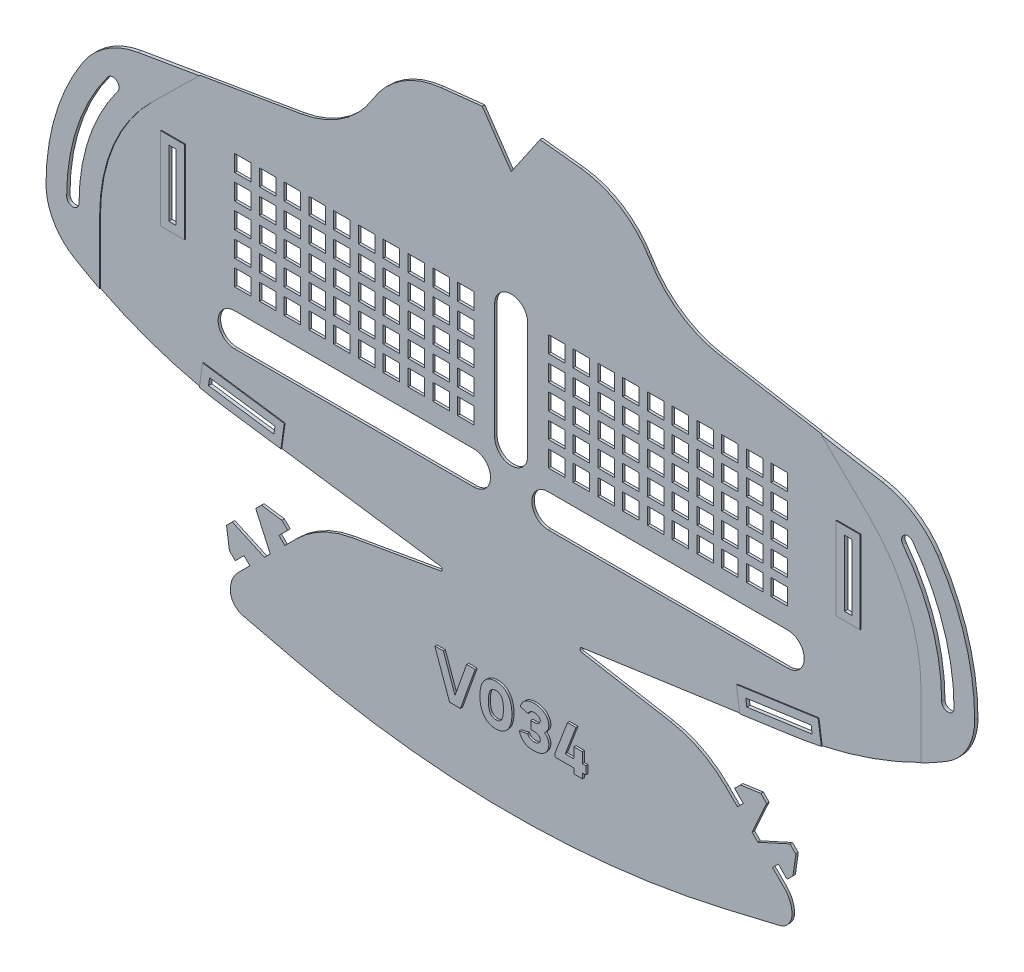
from build123d import *

# Parameters (mm, degrees)
MAIN_SHAPE_DEPTH                   = 0.6
ELASTIC_ATTACHMENT_POINTS_DEPTH    = 184.525502315
REINFORCED_ATTACHMENT_POINTS_DEPTH = 0.2
TAB_SLITS_DEPTH                    = 184.525502315
REINFORCED_TAB_SLITS_DEPTH         = 0.2
TAB_FLEX_RELIEF_DEPTH              = 184.525502315
TAB_FLEX_RELIEF_DEPTH_BACK         = 184.525502315
SKETCH3_W                          = 4
SKETCH3_H                          = 4
BREATHING_SLITS_DEPTH              = 184.525502315
VERSION_NUMBER_DEPTH               = 0.5
FILLET1_R                          = 0.5
TAB_OVERLAY_SLIT_DEPTH             = 184.525502394
TAB_OVERLAY_SLIT_DEPTH_BACK        = 184.525502394
SKETCH12_W                         = 1.8
SKETCH12_H                         = 16
SKETCH13_W                         = 5.8
SKETCH13_H                         = 20
SKETCH13_W_2                       = 1.8
SKETCH13_H_2                       = 16
TAB_OVERLAY_REINFORCEMENT_DEPTH    = 0.2


with BuildPart() as part:
    # Sketch1 → Main Shape (new body)
    with BuildSketch(Plane.XY):
        with BuildLine():
            Line((0, -10.235233266), (-7, 0))
            Line((-7, 0), (-16.941855461, -1.076805455))
            ThreePointArc((-16.941855461, -1.076805455), (-26.448172688, -4.42923559), (-33.461443341, -11.669600897))
            ThreePointArc((-33.461443341, -11.669600897), (-40.804108255, -19.481824954), (-50.74391922, -23.5))
            Line((-50.74391922, -23.5), (-90.180351554, -30.190874742))
            ThreePointArc((-90.180351554, -30.190874742), (-97.811505455, -33.190405434), (-103.597722286, -39))
            ThreePointArc((-103.597722286, -39), (-110.227482046, -53.35351039), (-112.5, -69))
            ThreePointArc((-112.5, -69), (-110.685143325, -75.893640703), (-105.711102551, -81))
            ThreePointArc((-105.711102551, -81), (-87.655491519, -89.524485559), (-68.266232563, -94.291935705))
            Line((-68.266232563, -94.291935705), (-14, -102))
            Line((-14, -102), (-38.626554922, -106.304973016))
            ThreePointArc((-38.626554922, -106.304973016), (-45.849449199, -108.748014338), (-52, -113.254607005))
            Line((-52, -113.254607005), (-54.828307349, -116.0831539))
            Line((-54.828307349, -116.0831539), (-56.242580797, -114.669000226))
            Line((-56.242580797, -114.669000226), (-54.121350285, -112.547590054))
            Line((-54.121350285, -112.547590054), (-55.535623732, -111.13343638))
            Line((-55.535623732, -111.13343638), (-60.48540114, -110.426539202))
            Line((-60.48540114, -110.426539202), (-68.970323187, -118.912179887))
            Line((-68.970323187, -118.912179887), (-68.263006804, -123.861897408))
            Line((-68.263006804, -123.861897408), (-66.848733357, -125.276051082))
            Line((-66.848733357, -125.276051082), (-64.727502845, -123.154640911))
            Line((-64.727502845, -123.154640911), (-63.313229397, -124.568794586))
            Line((-63.313229397, -124.568794586), (-66.141536747, -127.397341481))
            ThreePointArc((-66.141536747, -127.397341481), (-67.550417669, -129.506025763), (-68.045148042, -131.993340924))
            ThreePointArc((-68.045148042, -131.993340924), (-67.183295285, -134.473669911), (-64.9691321, -135.885159709))
            Line((-64.9691321, -135.885159709), (-52.436095294, -138.860716087))
            ThreePointArc((-52.436095294, -138.860716087), (-26.397134772, -143.459954927), (0, -145))
            ThreePointArc((0, -145), (26.397134772, -143.459954927), (52.436095294, -138.860716087))
            Line((52.436095294, -138.860716087), (64.9691321, -135.885159709))
            ThreePointArc((64.9691321, -135.885159709), (67.183295285, -134.473669911), (68.045148042, -131.993340924))
            ThreePointArc((68.045148042, -131.993340924), (67.550417669, -129.506025763), (66.141536747, -127.397341481))
            Line((66.141536747, -127.397341481), (63.313229397, -124.568794586))
            Line((63.313229397, -124.568794586), (64.727502845, -123.154640911))
            Line((64.727502845, -123.154640911), (66.848733357, -125.276051082))
            Line((66.848733357, -125.276051082), (68.263006804, -123.861897408))
            Line((68.263006804, -123.861897408), (68.970323187, -118.912179887))
            Line((68.970323187, -118.912179887), (60.48540114, -110.426539202))
            Line((60.48540114, -110.426539202), (55.535623732, -111.13343638))
            Line((55.535623732, -111.13343638), (54.121350285, -112.547590054))
            Line((54.121350285, -112.547590054), (56.242580797, -114.669000226))
            Line((56.242580797, -114.669000226), (54.828307349, -116.0831539))
            Line((54.828307349, -116.0831539), (52, -113.254607005))
            ThreePointArc((52, -113.254607005), (45.849449199, -108.748014338), (38.626554922, -106.304973016))
            Line((38.626554922, -106.304973016), (14, -102))
            Line((14, -102), (68.266232563, -94.291935705))
            ThreePointArc((68.266232563, -94.291935705), (87.655491519, -89.524485559), (105.711102551, -81))
            ThreePointArc((105.711102551, -81), (110.685143325, -75.893640703), (112.5, -69))
            ThreePointArc((112.5, -69), (110.227482046, -53.35351039), (103.597722286, -39))
            ThreePointArc((103.597722286, -39), (97.811505455, -33.190405434), (90.180351554, -30.190874742))
            Line((90.180351554, -30.190874742), (50.74391922, -23.5))
            ThreePointArc((50.74391922, -23.5), (40.804108255, -19.481824954), (33.461443341, -11.669600897))
            ThreePointArc((33.461443341, -11.669600897), (26.448172688, -4.42923559), (16.941855461, -1.076805455))
            Line((16.941855461, -1.076805455), (7, 0))
            Line((7, 0), (0, -10.235233266))
        make_face()
    extrude(amount=MAIN_SHAPE_DEPTH)

    # Sketch2 → Elastic Attachment Points (cut, through all)
    with BuildSketch(Plane.XY.offset(0.6)):
        with BuildLine():
            ThreePointArc((-97.5, -39), (-104.934164903, -53.188611699), (-107.5, -69))
            ThreePointArc((-107.5, -69), (-106, -70.5), (-104.5, -69))
            ThreePointArc((-104.5, -69), (-102.088115008, -54.137294997), (-95.1, -40.8))
            ThreePointArc((-95.1, -40.8), (-95.4, -38.7), (-97.5, -39))
        make_face()
        with BuildLine():
            ThreePointArc((97.5, -39), (104.934164903, -53.188611699), (107.5, -69))
            ThreePointArc((107.5, -69), (106, -70.5), (104.5, -69))
            ThreePointArc((104.5, -69), (102.088115008, -54.137294997), (95.1, -40.8))
            ThreePointArc((95.1, -40.8), (95.4, -38.7), (97.5, -39))
        make_face()
    extrude(amount=-ELASTIC_ATTACHMENT_POINTS_DEPTH, mode=Mode.SUBTRACT)

    # Sketch7 → Reinforced Attachment Points (add)
    # profile 1 of 2: a face of its own
    with BuildSketch(Plane.XY.offset(0.6)):
        with BuildLine():
            Line((-99.5, -69), (-99.5, -84.438405623))
            ThreePointArc((-99.5, -84.438405623), (-102.636073846, -82.774338486), (-105.711102551, -81))
            ThreePointArc((-105.711102551, -81), (-110.685143325, -75.893640703), (-112.5, -69))
            ThreePointArc((-112.5, -69), (-110.227482046, -53.35351039), (-103.597722286, -39))
            ThreePointArc((-103.597722286, -39), (-97.811505455, -33.190405434), (-90.180351554, -30.190874742))
            Line((-90.180351554, -30.190874742), (-75.331937335, -27.671659038))
            Line((-75.331937335, -27.671659038), (-86.893876913, -39))
            ThreePointArc((-86.893876913, -39), (-96.22042633, -52.729517991), (-99.5, -69))
        make_face()
        with BuildLine():
            ThreePointArc((-107.5, -69), (-106, -70.5), (-104.5, -69))
            ThreePointArc((-104.5, -69), (-102.088115008, -54.137294997), (-95.1, -40.8))
            ThreePointArc((-95.1, -40.8), (-95.4, -38.7), (-97.5, -39))
            ThreePointArc((-97.5, -39), (-104.934164903, -53.188611699), (-107.5, -69))
        make_face(mode=Mode.SUBTRACT)
    # profile 2 of 2: a face of its own
    with BuildSketch(Plane.XY.offset(0.6)):
        with BuildLine():
            Line((75.331937335, -27.671659038), (90.180351554, -30.190874742))
            ThreePointArc((90.180351554, -30.190874742), (97.811505455, -33.190405434), (103.597722286, -39))
            ThreePointArc((103.597722286, -39), (110.227482046, -53.35351039), (112.5, -69))
            ThreePointArc((112.5, -69), (110.685143325, -75.893640703), (105.711102551, -81))
            ThreePointArc((105.711102551, -81), (102.636073846, -82.774338486), (99.5, -84.438405623))
            Line((99.5, -84.438405623), (99.5, -69))
            ThreePointArc((99.5, -69), (96.22042633, -52.729517991), (86.893876913, -39))
            Line((86.893876913, -39), (75.331937335, -27.671659038))
        make_face()
        with BuildLine():
            ThreePointArc((104.5, -69), (106, -70.5), (107.5, -69))
            ThreePointArc((107.5, -69), (104.934164903, -53.188611699), (97.5, -39))
            ThreePointArc((97.5, -39), (95.4, -38.7), (95.1, -40.8))
            ThreePointArc((95.1, -40.8), (102.088115008, -54.137294997), (104.5, -69))
        make_face(mode=Mode.SUBTRACT)
    extrude(amount=REINFORCED_ATTACHMENT_POINTS_DEPTH)

    # Sketch6 → Tab Slits (cut, through all)
    with BuildSketch(Plane.XY.offset(0.6)):
        Polygon((-73.122472744, -91.582072346), (-57.281477317, -93.832153206), (-57.02834322, -92.050041221), (-72.869338647, -89.79996036), align=None)
        Polygon((73.122472744, -91.582072346), (72.869338647, -89.79996036), (57.02834322, -92.050041221), (57.281477317, -93.832153206), align=None)
    extrude(amount=-TAB_SLITS_DEPTH, mode=Mode.SUBTRACT)

    # Sketch9 → Reinforced Tab Slits (add)
    # profile 1 of 2: a face of its own
    with BuildSketch(Plane.XY.offset(0.6)):
        with BuildLine():
            Line((-55.582612996, -96.093537742), (-54.766958684, -90.3511769))
            Line((-54.766958684, -90.3511769), (-74.568202968, -87.538575825))
            Line((-74.568202968, -87.538575825), (-75.347469499, -93.024759795))
            ThreePointArc((-75.347469499, -93.024759795), (-71.81824936, -93.72204393), (-68.266232563, -94.291935705))
            Line((-68.266232563, -94.291935705), (-55.582612996, -96.093537742))
        make_face()
        Polygon((-57.281477317, -93.832153206), (-57.02834322, -92.050041221), (-72.869338647, -89.79996036), (-73.122472744, -91.582072346), align=None, mode=Mode.SUBTRACT)
    # profile 2 of 2: a face of its own
    with BuildSketch(Plane.XY.offset(0.6)):
        with BuildLine():
            Line((68.266232563, -94.291935705), (55.582612996, -96.093537742))
            Line((55.582612996, -96.093537742), (54.766958684, -90.3511769))
            Line((54.766958684, -90.3511769), (74.568202968, -87.538575825))
            Line((74.568202968, -87.538575825), (75.347469499, -93.024759795))
            ThreePointArc((75.347469499, -93.024759795), (71.81824936, -93.72204393), (68.266232563, -94.291935705))
        make_face()
        Polygon((57.02834322, -92.050041221), (72.869338647, -89.79996036), (73.122472744, -91.582072346), (57.281477317, -93.832153206), align=None, mode=Mode.SUBTRACT)
    extrude(amount=REINFORCED_TAB_SLITS_DEPTH)

    # Sketch11 → Tab Flex Relief (cut, two sides: drawn at the far end of the back side and taken through both)
    with BuildSketch(Plane.XY.offset(0.6).offset(-TAB_FLEX_RELIEF_DEPTH_BACK)):
        Polygon((-67.556169513, -117.49790644), (-59.777845211, -121.033110967), (-58.363691536, -119.618837519), (-61.899554814, -111.840812649), align=None)
        Polygon((61.899554814, -111.840812649), (67.556169513, -117.49790644), (59.777845211, -121.033110967), (58.363691536, -119.618837519), align=None)
    extrude(amount=TAB_FLEX_RELIEF_DEPTH + TAB_FLEX_RELIEF_DEPTH_BACK, mode=Mode.SUBTRACT)

    # Sketch3 → Breathing Slits (cut, through all)
    with BuildSketch(Plane.XY.offset(0.6)):
        with Locations((-11, -41.9)):
            Rectangle(SKETCH3_W, SKETCH3_H)
        with BuildLine():
            Line((4, -39.9), (4, -67.9))
            ThreePointArc((4, -67.9), (0, -71.9), (-4, -67.9))
            Line((-4, -67.9), (-4, -39.9))
            ThreePointArc((-4, -39.9), (0, -35.9), (4, -39.9))
        make_face()
        with Locations((-17, -41.9)):
            Rectangle(SKETCH3_W, SKETCH3_H)
        with Locations((-23, -41.9)):
            Rectangle(SKETCH3_W, SKETCH3_H)
        with Locations((-29, -41.9)):
            Rectangle(SKETCH3_W, SKETCH3_H)
        with Locations((-35, -41.9)):
            Rectangle(SKETCH3_W, SKETCH3_H)
        with BuildLine():
            Line((-67, -72.9), (-9, -72.9))
            ThreePointArc((-9, -72.9), (-5, -76.9), (-9, -80.9))
            Line((-9, -80.9), (-67, -80.9))
            ThreePointArc((-67, -80.9), (-71, -76.9), (-67, -72.9))
        make_face()
        with BuildLine():
            Line((67, -72.9), (9, -72.9))
            ThreePointArc((9, -72.9), (5, -76.9), (9, -80.9))
            Line((9, -80.9), (67, -80.9))
            ThreePointArc((67, -80.9), (71, -76.9), (67, -72.9))
        make_face()
        with Locations((-41, -41.9)):
            Rectangle(SKETCH3_W, SKETCH3_H)
        with Locations((-47, -41.9)):
            Rectangle(SKETCH3_W, SKETCH3_H)
        with Locations((-53, -41.9)):
            Rectangle(SKETCH3_W, SKETCH3_H)
        with Locations((-59, -41.9)):
            Rectangle(SKETCH3_W, SKETCH3_H)
        with Locations((-65, -41.9)):
            Rectangle(SKETCH3_W, SKETCH3_H)
        with Locations((-17, -47.9)):
            Rectangle(SKETCH3_W, SKETCH3_H)
        with Locations((-23, -47.9)):
            Rectangle(SKETCH3_W, SKETCH3_H)
        with Locations((-29, -47.9)):
            Rectangle(SKETCH3_W, SKETCH3_H)
        with Locations((-35, -47.9)):
            Rectangle(SKETCH3_W, SKETCH3_H)
        with Locations((-41, -47.9)):
            Rectangle(SKETCH3_W, SKETCH3_H)
        with Locations((-47, -47.9)):
            Rectangle(SKETCH3_W, SKETCH3_H)
        with Locations((-53, -47.9)):
            Rectangle(SKETCH3_W, SKETCH3_H)
        with Locations((-59, -47.9)):
            Rectangle(SKETCH3_W, SKETCH3_H)
        with Locations((-65, -47.9)):
            Rectangle(SKETCH3_W, SKETCH3_H)
        with Locations((-17, -53.9)):
            Rectangle(SKETCH3_W, SKETCH3_H)
        with Locations((-23, -53.9)):
            Rectangle(SKETCH3_W, SKETCH3_H)
        with Locations((-29, -53.9)):
            Rectangle(SKETCH3_W, SKETCH3_H)
        with Locations((-35, -53.9)):
            Rectangle(SKETCH3_W, SKETCH3_H)
        with Locations((-41, -53.9)):
            Rectangle(SKETCH3_W, SKETCH3_H)
        with Locations((-47, -53.9)):
            Rectangle(SKETCH3_W, SKETCH3_H)
        with Locations((-53, -53.9)):
            Rectangle(SKETCH3_W, SKETCH3_H)
        with Locations((-59, -53.9)):
            Rectangle(SKETCH3_W, SKETCH3_H)
        with Locations((-65, -53.9)):
            Rectangle(SKETCH3_W, SKETCH3_H)
        with Locations((-17, -59.9)):
            Rectangle(SKETCH3_W, SKETCH3_H)
        with Locations((-23, -59.9)):
            Rectangle(SKETCH3_W, SKETCH3_H)
        with Locations((-29, -59.9)):
            Rectangle(SKETCH3_W, SKETCH3_H)
        with Locations((-35, -59.9)):
            Rectangle(SKETCH3_W, SKETCH3_H)
        with Locations((-41, -59.9)):
            Rectangle(SKETCH3_W, SKETCH3_H)
        with Locations((-47, -59.9)):
            Rectangle(SKETCH3_W, SKETCH3_H)
        with Locations((-53, -59.9)):
            Rectangle(SKETCH3_W, SKETCH3_H)
        with Locations((-59, -59.9)):
            Rectangle(SKETCH3_W, SKETCH3_H)
        with Locations((-65, -59.9)):
            Rectangle(SKETCH3_W, SKETCH3_H)
        with Locations((-17, -65.9)):
            Rectangle(SKETCH3_W, SKETCH3_H)
        with Locations((-23, -65.9)):
            Rectangle(SKETCH3_W, SKETCH3_H)
        with Locations((-29, -65.9)):
            Rectangle(SKETCH3_W, SKETCH3_H)
        with Locations((-35, -65.9)):
            Rectangle(SKETCH3_W, SKETCH3_H)
        with Locations((-41, -65.9)):
            Rectangle(SKETCH3_W, SKETCH3_H)
        with Locations((-47, -65.9)):
            Rectangle(SKETCH3_W, SKETCH3_H)
        with Locations((-53, -65.9)):
            Rectangle(SKETCH3_W, SKETCH3_H)
        with Locations((-59, -65.9)):
            Rectangle(SKETCH3_W, SKETCH3_H)
        with Locations((-65, -65.9)):
            Rectangle(SKETCH3_W, SKETCH3_H)
        with Locations((-11, -47.9)):
            Rectangle(SKETCH3_W, SKETCH3_H)
        with Locations((-11, -53.9)):
            Rectangle(SKETCH3_W, SKETCH3_H)
        with Locations((-11, -59.9)):
            Rectangle(SKETCH3_W, SKETCH3_H)
        with Locations((-11, -65.9)):
            Rectangle(SKETCH3_W, SKETCH3_H)
        with Locations((11, -65.9)):
            Rectangle(SKETCH3_W, SKETCH3_H)
        with Locations((11, -59.9)):
            Rectangle(SKETCH3_W, SKETCH3_H)
        with Locations((11, -53.9)):
            Rectangle(SKETCH3_W, SKETCH3_H)
        with Locations((11, -47.9)):
            Rectangle(SKETCH3_W, SKETCH3_H)
        with Locations((65, -65.9)):
            Rectangle(SKETCH3_W, SKETCH3_H)
        with Locations((59, -65.9)):
            Rectangle(SKETCH3_W, SKETCH3_H)
        with Locations((53, -65.9)):
            Rectangle(SKETCH3_W, SKETCH3_H)
        with Locations((47, -65.9)):
            Rectangle(SKETCH3_W, SKETCH3_H)
        with Locations((41, -65.9)):
            Rectangle(SKETCH3_W, SKETCH3_H)
        with Locations((35, -65.9)):
            Rectangle(SKETCH3_W, SKETCH3_H)
        with Locations((29, -65.9)):
            Rectangle(SKETCH3_W, SKETCH3_H)
        with Locations((23, -65.9)):
            Rectangle(SKETCH3_W, SKETCH3_H)
        with Locations((17, -65.9)):
            Rectangle(SKETCH3_W, SKETCH3_H)
        with Locations((65, -59.9)):
            Rectangle(SKETCH3_W, SKETCH3_H)
        with Locations((59, -59.9)):
            Rectangle(SKETCH3_W, SKETCH3_H)
        with Locations((53, -59.9)):
            Rectangle(SKETCH3_W, SKETCH3_H)
        with Locations((47, -59.9)):
            Rectangle(SKETCH3_W, SKETCH3_H)
        with Locations((41, -59.9)):
            Rectangle(SKETCH3_W, SKETCH3_H)
        with Locations((35, -59.9)):
            Rectangle(SKETCH3_W, SKETCH3_H)
        with Locations((29, -59.9)):
            Rectangle(SKETCH3_W, SKETCH3_H)
        with Locations((23, -59.9)):
            Rectangle(SKETCH3_W, SKETCH3_H)
        with Locations((17, -59.9)):
            Rectangle(SKETCH3_W, SKETCH3_H)
        with Locations((65, -53.9)):
            Rectangle(SKETCH3_W, SKETCH3_H)
        with Locations((59, -53.9)):
            Rectangle(SKETCH3_W, SKETCH3_H)
        with Locations((53, -53.9)):
            Rectangle(SKETCH3_W, SKETCH3_H)
        with Locations((47, -53.9)):
            Rectangle(SKETCH3_W, SKETCH3_H)
        with Locations((41, -53.9)):
            Rectangle(SKETCH3_W, SKETCH3_H)
        with Locations((35, -53.9)):
            Rectangle(SKETCH3_W, SKETCH3_H)
        with Locations((29, -53.9)):
            Rectangle(SKETCH3_W, SKETCH3_H)
        with Locations((23, -53.9)):
            Rectangle(SKETCH3_W, SKETCH3_H)
        with Locations((17, -53.9)):
            Rectangle(SKETCH3_W, SKETCH3_H)
        with Locations((65, -47.9)):
            Rectangle(SKETCH3_W, SKETCH3_H)
        with Locations((59, -47.9)):
            Rectangle(SKETCH3_W, SKETCH3_H)
        with Locations((53, -47.9)):
            Rectangle(SKETCH3_W, SKETCH3_H)
        with Locations((47, -47.9)):
            Rectangle(SKETCH3_W, SKETCH3_H)
        with Locations((41, -47.9)):
            Rectangle(SKETCH3_W, SKETCH3_H)
        with Locations((35, -47.9)):
            Rectangle(SKETCH3_W, SKETCH3_H)
        with Locations((29, -47.9)):
            Rectangle(SKETCH3_W, SKETCH3_H)
        with Locations((23, -47.9)):
            Rectangle(SKETCH3_W, SKETCH3_H)
        with Locations((17, -47.9)):
            Rectangle(SKETCH3_W, SKETCH3_H)
        with Locations((65, -41.9)):
            Rectangle(SKETCH3_W, SKETCH3_H)
        with Locations((59, -41.9)):
            Rectangle(SKETCH3_W, SKETCH3_H)
        with Locations((53, -41.9)):
            Rectangle(SKETCH3_W, SKETCH3_H)
        with Locations((47, -41.9)):
            Rectangle(SKETCH3_W, SKETCH3_H)
        with Locations((41, -41.9)):
            Rectangle(SKETCH3_W, SKETCH3_H)
        with Locations((35, -41.9)):
            Rectangle(SKETCH3_W, SKETCH3_H)
        with Locations((29, -41.9)):
            Rectangle(SKETCH3_W, SKETCH3_H)
        with Locations((23, -41.9)):
            Rectangle(SKETCH3_W, SKETCH3_H)
        with Locations((17, -41.9)):
            Rectangle(SKETCH3_W, SKETCH3_H)
        with Locations((11, -41.9)):
            Rectangle(SKETCH3_W, SKETCH3_H)
    extrude(amount=-BREATHING_SLITS_DEPTH, mode=Mode.SUBTRACT)

    # Sketch8 → Version Number (add)
    # profile 1 of 4: a face of its own
    with BuildSketch(Plane.XY.offset(0.6)):
        Polygon((-14.426521706, -128.5), (-11.791601071, -128.5), (-8.2201725, -118.5), (-10.283664563, -118.5), (-13.109061389, -126.420634921), (-15.934458214, -118.5), (-17.997950277, -118.5), align=None)
    # profile 2 of 4: a face of its own
    with BuildSketch(Plane.XY.offset(0.6)):
        with BuildLine():
            add(Edge.make_bspline(
                [(-3.19799782, -118.5), (-3.342363784, -118.505695671), (-3.625118931, -118.51685121), (-4.038253933, -118.5745591), (-4.426096636, -118.680335178), (-4.793298212, -118.819656178), (-5.135573783, -119.003303471), (-5.459366958, -119.221085059), (-5.752377573, -119.487440084), (-6.027832626, -119.785519386), (-6.273695806, -120.12453761), (-6.487131516, -120.500892889), (-6.669094292, -120.912503383), (-6.818015456, -121.360169436), (-6.933564505, -121.844506854), (-7.021318443, -122.364485904), (-7.072872883, -122.921030718), (-7.083529613, -123.303893775), (-7.089008194, -123.500722112)],
                knots=[0, 0, 0, 0, 0.970159994, 1.900155169, 2.79438565, 3.665191596, 4.532301255, 5.397946305, 6.279238358, 7.185391655, 8.120220805, 9.085107467, 10.08639026, 11.138349125, 12.249459105, 13.427760297, 14.677622047, 16, 16, 16, 16], degree=3))
            add(Edge.make_bspline(
                [(-7.089008194, -123.500722112), (-7.083584804, -123.69832053), (-7.073076177, -124.081196856), (-7.021109107, -124.637697099), (-6.933663218, -125.156966907), (-6.817553361, -125.641884177), (-6.669610698, -126.090648826), (-6.487064073, -126.502814664), (-6.273753768, -126.879260377), (-6.027672588, -127.218032326), (-5.753280851, -127.51659595), (-5.457813305, -127.779877259), (-5.136462062, -128.000979952), (-4.793104757, -128.183632701), (-4.426551703, -128.324409639), (-4.037598623, -128.425104033), (-3.625820303, -128.488808035), (-3.343038929, -128.496221224), (-3.198894854, -128.5)],
                knots=[0, 0, 0, 0, 1.327400251, 2.57203543, 3.750234214, 4.861247624, 5.917991082, 6.919186852, 7.883989653, 8.818737555, 9.724812096, 10.602616666, 11.47109776, 12.338132057, 13.208862319, 14.101698703, 15.032365954, 16, 16, 16, 16], degree=3))
            add(Edge.make_bspline(
                [(-3.198894854, -128.5), (-3.054755185, -128.496210687), (-2.771982456, -128.488776824), (-2.360142042, -128.425221319), (-1.970719711, -128.323813307), (-1.603358232, -128.184839888), (-1.260968753, -128.000200623), (-0.939922347, -127.779984633), (-0.644523678, -127.516566079), (-0.370113879, -127.218040576), (-0.124033252, -126.879258594), (0.08925949, -126.502813072), (0.271881367, -126.090657611), (0.419519105, -125.641847927), (0.536831956, -125.157235462), (0.619274102, -124.637275213), (0.676930327, -124.081441513), (0.684840695, -123.698369528), (0.688922079, -123.500722112)],
                knots=[0, 0, 0, 0, 0.96765053, 1.898333634, 2.791185227, 3.666728435, 4.529238626, 5.397734515, 6.275554038, 7.181644014, 8.116407839, 9.081227075, 10.082439899, 11.139201358, 12.250233695, 13.427610983, 14.672766316, 16, 16, 16, 16], degree=3))
            add(Edge.make_bspline(
                [(0.688922079, -123.500722112), (0.684781249, -123.303845261), (0.676724545, -122.920787111), (0.619480566, -122.364907693), (0.536732372, -121.844238468), (0.419982735, -121.360205444), (0.271364771, -120.912494629), (0.089326953, -120.500894477), (-0.124091224, -120.124539393), (-0.369953818, -119.785511139), (-0.645427056, -119.487469991), (-0.938368264, -119.220977415), (-1.261853126, -119.004075275), (-1.603164774, -118.818455332), (-1.971175337, -118.680915067), (-2.35949197, -118.574534625), (-2.772341048, -118.516562336), (-3.054825879, -118.506550382), (-3.198894854, -118.501444225)],
                knots=[0, 0, 0, 0, 1.322391154, 2.572941942, 3.750582404, 4.861863084, 5.913983562, 6.915420183, 7.880455081, 8.815427849, 9.721720359, 10.603147806, 11.468925845, 12.331628829, 13.207367743, 14.101735605, 15.031873656, 16, 16, 16, 16], degree=3))
            Line((-3.198894854, -118.501444225), (-3.19799782, -118.5))
        make_face()
        with BuildLine():
            add(Edge.make_bspline(
                [(-3.19799782, -126.579365079), (-3.267317368, -126.580142247), (-3.403327694, -126.581667111), (-3.600780931, -126.549518886), (-3.787232026, -126.50001124), (-3.961409321, -126.424863461), (-4.125204682, -126.32888552), (-4.275820225, -126.207295998), (-4.414179248, -126.063513987), (-4.541494306, -125.896932623), (-4.655365609, -125.703005633), (-4.753896598, -125.478827118), (-4.834634013, -125.222713054), (-4.903810771, -124.937433189), (-4.955062135, -124.621763618), (-4.993565701, -124.276117752), (-5.019432364, -123.899148475), (-5.022791639, -123.63702081), (-5.024538364, -123.500722112)],
                knots=[0, 0, 0, 0, 0.820209436, 1.609314487, 2.362064528, 3.101854642, 3.850272983, 4.605479342, 5.3882482, 6.210255141, 7.084711649, 8.047345167, 9.106040688, 10.263495908, 11.523832392, 12.893430008, 14.384674726, 16, 16, 16, 16], degree=3))
            add(Edge.make_bspline(
                [(-5.024538364, -123.500722112), (-5.022784753, -123.364424703), (-5.019412233, -123.102299516), (-4.993636589, -122.725313211), (-4.954743615, -122.378974061), (-4.904447331, -122.063111109), (-4.834229908, -121.778059679), (-4.753926876, -121.522619394), (-4.655396716, -121.298401339), (-4.541362056, -121.104640769), (-4.414971752, -120.937923887), (-4.275009266, -120.796456824), (-4.125288515, -120.674830172), (-3.961448631, -120.578630118), (-3.78680261, -120.50465551), (-3.601435064, -120.450210023), (-3.403291355, -120.423926373), (-3.267848082, -120.422146526), (-3.198894854, -120.421240419)],
                knots=[0, 0, 0, 0, 1.616177311, 3.108208617, 4.478528655, 5.748482895, 6.897727805, 7.956981757, 8.920123036, 9.795040793, 10.617481319, 11.394165711, 12.149770419, 12.898583529, 13.63876386, 14.394368568, 15.182584207, 16, 16, 16, 16], degree=3))
            add(Edge.make_bspline(
                [(-3.198894854, -120.421240419), (-3.129943219, -120.422149219), (-2.994503075, -120.423934355), (-2.796336854, -120.450179948), (-2.611050266, -120.504762296), (-2.43671692, -120.577982734), (-2.274491584, -120.675595023), (-2.125021827, -120.796360516), (-1.98512158, -120.937948802), (-1.858757268, -121.104645093), (-1.744532531, -121.298351736), (-1.64674725, -121.523063414), (-1.562787392, -121.777554553), (-1.493598293, -122.063195246), (-1.442968614, -122.378948588), (-1.404176499, -122.725320897), (-1.378370835, -123.102297333), (-1.375002684, -123.364423957), (-1.373251344, -123.500722112)],
                knots=[0, 0, 0, 0, 0.817669415, 1.606129616, 2.361968767, 3.102378757, 3.843623451, 4.599462602, 5.376387978, 6.199083685, 7.074272906, 8.037713021, 9.100132017, 10.249733507, 11.520081779, 12.89082699, 14.383321233, 16, 16, 16, 16], degree=3))
            add(Edge.make_bspline(
                [(-1.373251344, -123.500722112), (-1.374995798, -123.637021556), (-1.378350706, -123.899150658), (-1.404247382, -124.276110066), (-1.442650332, -124.621789015), (-1.494233551, -124.937349474), (-1.562375415, -125.223220708), (-1.646776928, -125.478383327), (-1.744563783, -125.703055181), (-1.858624962, -125.896928348), (-1.985914104, -126.063488884), (-2.124210194, -126.207393621), (-2.274574284, -126.328120602), (-2.436755511, -126.425517476), (-2.610620761, -126.499891817), (-2.796990099, -126.549600883), (-2.994179728, -126.581404352), (-3.129878263, -126.580608552), (-3.198894854, -126.580203806)],
                knots=[0, 0, 0, 0, 1.616177474, 3.108208932, 4.478529109, 5.739530511, 6.897596372, 7.959685938, 8.922827315, 9.797745161, 10.620185771, 11.403367596, 12.15897238, 12.899987232, 13.640167639, 14.39331481, 15.182836171, 16, 16, 16, 16], degree=3))
            Line((-3.198894854, -126.580203806), (-3.19799782, -126.579365079))
        make_face(mode=Mode.SUBTRACT)
    # profile 3 of 4: a face of its own
    with BuildSketch(Plane.XY.offset(0.6)):
        with BuildLine():
            Line((6.124606987, -124.404761905), (6.219845082, -124.404761905))
            add(Edge.make_bspline(
                [(6.219845082, -124.404761905), (6.320112978, -124.411299477), (6.510748179, -124.423729091), (6.777414476, -124.486416557), (7.010208564, -124.578961335), (7.201895942, -124.709274647), (7.355541243, -124.861365804), (7.469868682, -125.032278467), (7.539529926, -125.222537651), (7.548405363, -125.355662585), (7.552882394, -125.422814713)],
                knots=[0, 0, 0, 0, 1.293250512, 2.458803691, 3.516087315, 4.504014474, 5.424976382, 6.287022232, 7.135923681, 8, 8, 8, 8], degree=3))
            add(Edge.make_bspline(
                [(7.552882394, -125.422814713), (7.549592844, -125.504440638), (7.543231858, -125.662280257), (7.474084487, -125.887718235), (7.355729629, -126.087113891), (7.220813792, -126.23073656), (7.091649137, -126.331172702), (6.976760141, -126.395688771), (6.847909242, -126.450185226), (6.704881236, -126.49595932), (6.548159776, -126.532200484), (6.377200839, -126.560253509), (6.191377117, -126.575366879), (6.062538121, -126.5785552), (5.995918495, -126.580203806)],
                knots=[0, 0, 0, 0, 1.334208421, 2.579951764, 3.816761299, 5.103436918, 5.78324123, 6.491044783, 7.25516555, 8.072210043, 8.94833879, 9.888551629, 10.908219533, 12, 12, 12, 12], degree=3))
            add(Edge.make_bspline(
                [(5.995918495, -126.580203806), (5.921524904, -126.579024673), (5.771040312, -126.576639503), (5.544393766, -126.537785365), (5.316118808, -126.472292557), (5.089021408, -126.384048723), (4.874864808, -126.26078738), (4.697542279, -126.088542309), (4.556372523, -125.87591894), (4.501803369, -125.712337396), (4.473400701, -125.62719493)],
                knots=[0, 0, 0, 0, 0.920255672, 1.861508472, 2.836752399, 3.857684402, 4.873720033, 5.872631744, 6.892727297, 8, 8, 8, 8], degree=3))
            Line((4.473400701, -125.62719493), (2.489686352, -126.071428571))
            add(Edge.make_bspline(
                [(2.489686352, -126.071428571), (2.512521637, -126.160336196), (2.557477781, -126.335369884), (2.650486661, -126.586847228), (2.761924098, -126.824009097), (2.887080442, -127.050933458), (3.035231528, -127.26169635), (3.199400068, -127.459934114), (3.378631597, -127.647890635), (3.57896389, -127.819546753), (3.796410868, -127.976110236), (4.033557441, -128.112422888), (4.288122939, -128.230322428), (4.563660329, -128.322934743), (4.855777945, -128.399729339), (5.167046514, -128.45295857), (5.495877493, -128.491934936), (5.721758984, -128.497268097), (5.837466417, -128.5)],
                knots=[0, 0, 0, 0, 0.97897001, 1.927311989, 2.855460552, 3.773345826, 4.68872018, 5.599601379, 6.518067916, 7.456260856, 8.41049365, 9.372940738, 10.370680865, 11.39871829, 12.470472684, 13.590411754, 14.765692276, 16, 16, 16, 16], degree=3))
            add(Edge.make_bspline(
                [(5.837466417, -128.5), (5.993736303, -128.494245394), (6.296262354, -128.483104934), (6.734071143, -128.435865678), (7.139719525, -128.358387224), (7.513494317, -128.252017359), (7.85836801, -128.123277608), (8.16935343, -127.961059217), (8.451444866, -127.774497038), (8.699098888, -127.55815064), (8.913493601, -127.319870658), (9.105251175, -127.071551477), (9.263040466, -126.805353082), (9.39557112, -126.527874631), (9.494198744, -126.234513517), (9.565662447, -125.928607165), (9.607334849, -125.607680152), (9.612452482, -125.38925418), (9.615055818, -125.278141077)],
                knots=[0, 0, 0, 0, 1.338573179, 2.591371041, 3.766159492, 4.869841347, 5.915366975, 6.911991706, 7.866279139, 8.804635322, 9.718527085, 10.607232931, 11.486170613, 12.362759498, 13.235296616, 14.130311397, 15.048891017, 16, 16, 16, 16], degree=3))
            add(Edge.make_bspline(
                [(9.615055818, -125.278141077), (9.609707391, -125.181448476), (9.599180632, -124.991138356), (9.543865046, -124.713321084), (9.451505158, -124.451246621), (9.32231342, -124.20784025), (9.171113714, -123.977552327), (8.995982298, -123.764837772), (8.801585252, -123.566155092), (8.657160586, -123.449574998), (8.583969106, -123.39049458)],
                knots=[0, 0, 0, 0, 1.042147361, 2.051151675, 3.039496243, 4.024119517, 5.012016893, 6.002285516, 6.987598979, 8, 8, 8, 8], degree=3))
            add(Edge.make_bspline(
                [(8.583969106, -123.39049458), (8.657150141, -123.325162044), (8.801510898, -123.19628365), (8.99578302, -122.981710509), (9.169953725, -122.755542958), (9.323309478, -122.515248899), (9.450511002, -122.261642739), (9.543335091, -121.993228321), (9.599243355, -121.711764564), (9.609728742, -121.519933272), (9.615055818, -121.42247384)],
                knots=[0, 0, 0, 0, 1.026734164, 2.025389794, 3.025877614, 4.013273499, 5.006315215, 5.989929209, 6.978788314, 8, 8, 8, 8], degree=3))
            add(Edge.make_bspline(
                [(9.615055818, -121.42247384), (9.610973953, -121.322020203), (9.602954973, -121.124675201), (9.556012276, -120.835115028), (9.480834261, -120.558271626), (9.373392204, -120.294880847), (9.239976609, -120.042407113), (9.075164694, -119.803370965), (8.884135516, -119.574583887), (8.663304658, -119.361344215), (8.4166055, -119.166999953), (8.144797283, -118.995833154), (7.850258593, -118.84746887), (7.529482541, -118.730513446), (7.187566923, -118.632405283), (6.821687087, -118.562780212), (6.432611933, -118.515976725), (6.165223841, -118.506371293), (6.028068193, -118.501444225)],
                knots=[0, 0, 0, 0, 0.933249724, 1.833404674, 2.71837752, 3.592513965, 4.4704886, 5.365912677, 6.284554944, 7.234984132, 8.212272519, 9.196674926, 10.214289296, 11.269589965, 12.363543901, 13.515449053, 14.72555956, 16, 16, 16, 16], degree=3))
            add(Edge.make_bspline(
                [(6.028068193, -118.501444225), (5.91467584, -118.504384419), (5.693495081, -118.510119502), (5.370710811, -118.546209564), (5.064881506, -118.597359567), (4.776062781, -118.671164203), (4.505019223, -118.76520159), (4.25129714, -118.877770477), (4.014767607, -119.009217236), (3.797164337, -119.161041577), (3.596903761, -119.328960798), (3.415506773, -119.510905494), (3.25075978, -119.704452098), (3.106225604, -119.91288512), (2.976596128, -120.132286581), (2.870061099, -120.36651166), (2.775142141, -120.610059019), (2.731737923, -120.780460499), (2.709760178, -120.866743363)],
                knots=[0, 0, 0, 0, 1.229240767, 2.397731417, 3.51786287, 4.588673614, 5.625367482, 6.624717489, 7.594406979, 8.554388623, 9.496885304, 10.424058211, 11.336820069, 12.248524965, 13.170856983, 14.095351914, 15.035580601, 16, 16, 16, 16], degree=3))
            Line((2.709760178, -120.866743363), (4.616670479, -121.373015873))
            add(Edge.make_bspline(
                [(4.616670479, -121.373015873), (4.627968129, -121.326631527), (4.652484305, -121.22597637), (4.742985432, -121.081457089), (4.864834107, -120.927147787), (5.026046882, -120.771324055), (5.223424654, -120.625559671), (5.461514632, -120.514206488), (5.734599019, -120.446844288), (5.927428457, -120.430020784), (6.028068193, -120.421240419)],
                knots=[0, 0, 0, 0, 0.626586808, 1.359708585, 2.222843852, 3.223153095, 4.308434095, 5.447412619, 6.667777482, 8, 8, 8, 8], degree=3))
            add(Edge.make_bspline(
                [(6.028068193, -120.421240419), (6.100101179, -120.423218633), (6.238336667, -120.42701494), (6.435739989, -120.449676308), (6.616031617, -120.474391788), (6.777081022, -120.515621967), (6.92269603, -120.558109891), (7.047305216, -120.618078056), (7.158066551, -120.680273756), (7.272970239, -120.780934624), (7.387298229, -120.912654377), (7.490292182, -121.077310889), (7.550289196, -121.24921056), (7.552028265, -121.365405566), (7.552882394, -121.42247384)],
                knots=[0, 0, 0, 0, 1.26888152, 2.435057415, 3.499383416, 4.470882074, 5.362320585, 6.164854387, 6.902680001, 7.591682225, 8.843898063, 9.963361673, 10.999720905, 12, 12, 12, 12], degree=3))
            add(Edge.make_bspline(
                [(7.552882394, -121.42247384), (7.54781164, -121.49199044), (7.537733442, -121.630155711), (7.462454629, -121.827940252), (7.340929317, -122.008163808), (7.17760257, -122.171288708), (6.970266661, -122.307565764), (6.722729686, -122.408872593), (6.435849352, -122.47003825), (6.231994509, -122.480300003), (6.124517284, -122.485710249)],
                knots=[0, 0, 0, 0, 0.842573162, 1.674626639, 2.532888499, 3.465967991, 4.458251597, 5.524776888, 6.695002246, 8, 8, 8, 8], degree=3))
            Line((6.124517284, -122.485710249), (5.26746413, -122.484126984))
            Line((5.26746413, -122.484126984), (5.26746413, -124.404761905))
            Line((5.26746413, -124.404761905), (6.124606987, -124.404761905))
        make_face()
    # profile 4 of 4: a face of its own
    with BuildSketch(Plane.XY.offset(0.6)):
        Polygon((15.708827263, -128.5), (17.772319326, -128.5), (17.772319326, -127.246031746), (18.597716152, -127.246031746), (18.597716152, -125.325396825), (17.772319326, -125.325396825), (17.772319326, -122.785714286), (15.708827263, -122.785714286), (15.708827263, -125.325396825), (13.597716152, -125.325396825), (16.200890755, -118.5), (14.137398691, -118.5), (11.137398691, -126.388888889), (11.137398691, -127.246031746), (15.708827263, -127.246031746), align=None)
    extrude(amount=VERSION_NUMBER_DEPTH)

    # Fillet1
    fillet1_edges = [part.edges().sort_by_distance(p)[0] for p in [
        (-14, -102, 0.3),
        (14, -102, 0.3),
    ]]
    fillet(fillet1_edges, radius=FILLET1_R)

    # Sketch12 → Tab Overlay Slit (cut, two sides: drawn at the far end of the back side and taken through both)
    with BuildSketch(Plane.XY.offset(0.6).offset(-TAB_OVERLAY_SLIT_DEPTH_BACK)):
        with Locations((-81.845854153, -53.9)):
            Rectangle(SKETCH12_W, SKETCH12_H)
        with Locations((81.845854153, -53.9)):
            Rectangle(SKETCH12_W, SKETCH12_H)
    extrude(amount=TAB_OVERLAY_SLIT_DEPTH + TAB_OVERLAY_SLIT_DEPTH_BACK, mode=Mode.SUBTRACT)

    # Sketch13 → Tab Overlay Reinforcement (add)
    # profile 1 of 2: a face of its own
    with BuildSketch(Plane.XY.offset(0.6)):
        with Locations((-81.845854153, -53.9)):
            Rectangle(SKETCH13_W, SKETCH13_H)
        with Locations((-81.845854153, -53.9)):
            Rectangle(SKETCH13_W_2, SKETCH13_H_2, mode=Mode.SUBTRACT)
    # profile 2 of 2: a face of its own
    with BuildSketch(Plane.XY.offset(0.6)):
        with Locations((81.845854153, -53.9)):
            Rectangle(SKETCH13_W, SKETCH13_H)
        with Locations((81.845854153, -53.9)):
            Rectangle(SKETCH13_W_2, SKETCH13_H_2, mode=Mode.SUBTRACT)
    extrude(amount=TAB_OVERLAY_REINFORCEMENT_DEPTH)


solid = part.part
